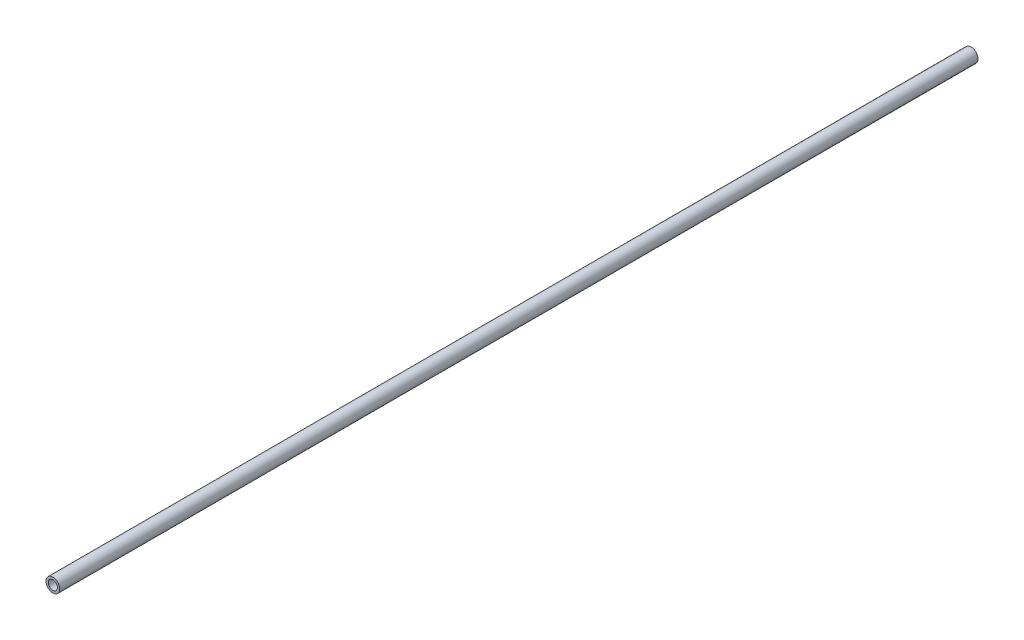
from build123d import *

# Parameters (mm, degrees)
SKETCH1_R           = 3
SKETCH1_R_2         = 2
BOSS_EXTRUDE1_DEPTH = 400


with BuildPart() as part:
    # Sketch1 → Boss-Extrude1 (new body)
    with BuildSketch(Plane.XY):
        Circle(SKETCH1_R)
        Circle(SKETCH1_R_2, mode=Mode.SUBTRACT)
    extrude(amount=BOSS_EXTRUDE1_DEPTH)


solid = part.part
